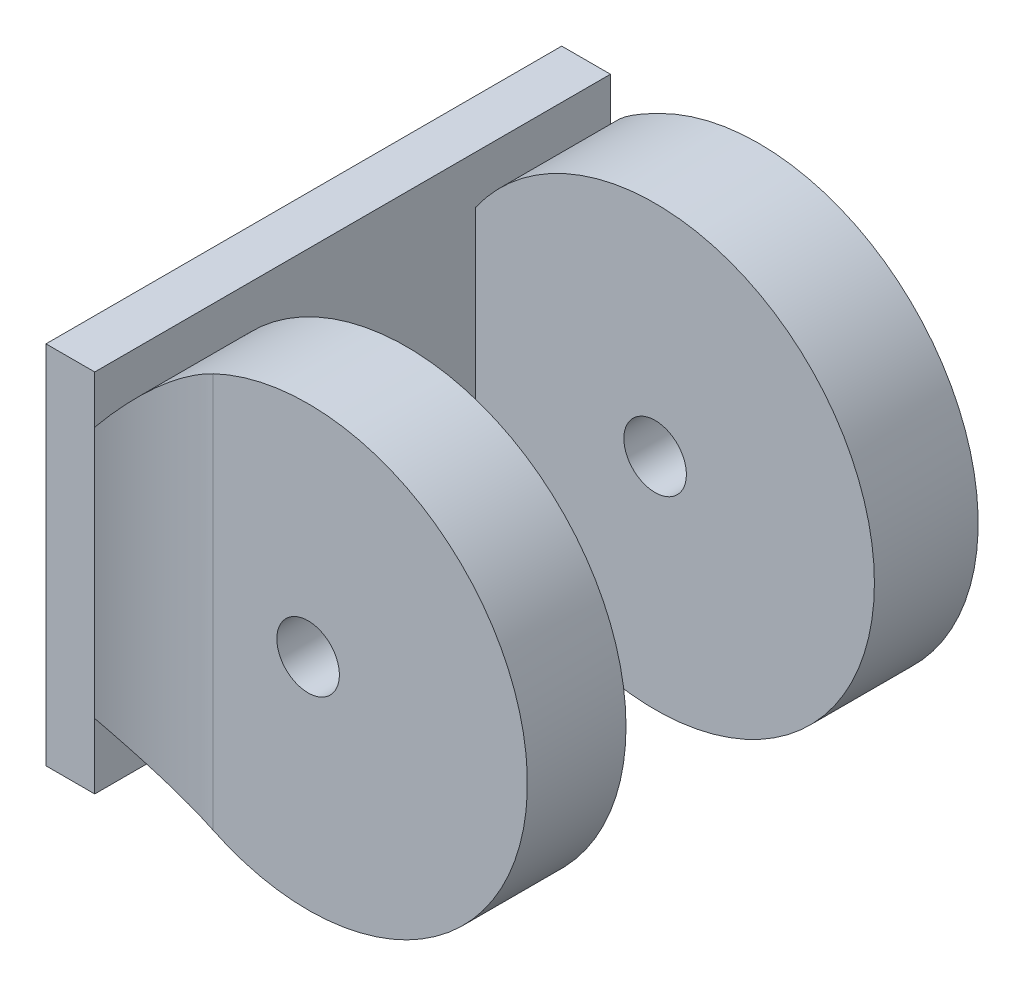
from build123d import *

# Parameters (mm, degrees)
BOSS_EXTRUDE1_DEPTH      = 9
BOSS_EXTRUDE1_DEPTH_BACK = 28
SKETCH1_R                = 18
SKETCH2_W                = 50.00806526
SKETCH2_H                = 20.388963247
CUT_EXTRUDE1_DEPTH       = 137
SKETCH6_R                = 2.56681782
CUT_EXTRUDE2_DEPTH       = 40
BOSS_EXTRUDE2_START      = 170
SKETCH7_W                = 42.331288986
SKETCH7_H                = 30
BOSS_EXTRUDE2_DEPTH      = 4
FILLET1_R                = 10


with BuildPart() as part:
    # Sketch1 → Boss-Extrude1 (new, two sides: drawn at the far end of the back side and taken through both)
    with BuildSketch(Plane(origin=(0, 0, 126.356389087), x_dir=(-1, 0, 0), z_dir=(0, 0, -1)).offset(-BOSS_EXTRUDE1_DEPTH_BACK)):
        with Locations((-188.724341924, 64.165727937)):
            Circle(SKETCH1_R)
    extrude(amount=BOSS_EXTRUDE1_DEPTH + BOSS_EXTRUDE1_DEPTH_BACK)

    # Sketch2 → Cut-Extrude1 (cut)
    with BuildSketch(Plane(origin=(-6.948170377, -29.446447031, 0), x_dir=(0.99748757373397, -0.07084165615171512, 3.115559675779194e-15), z_dir=(0.07084165615171512, 0.99748757373397, 0))):
        with Locations((192.53019978, -136.066593827)):
            Rectangle(SKETCH2_W, SKETCH2_H)
    extrude(amount=CUT_EXTRUDE1_DEPTH, mode=Mode.SUBTRACT)


with BuildPart() as cut_extrude1_piece_1:
    # of the separate pieces the step leaves, piece 1, a body of its own (cut_extrude1_pieces)
    add(part.part.solids().sort_by_distance((170.724341924, 64.165727937, 125.872112203))[0])


with BuildPart() as cut_extrude1_piece_2:
    # of the separate pieces the step leaves, piece 2, a body of its own (cut_extrude1_pieces)
    add(part.part.solids().sort_by_distance((170.724341924, 64.165727937, 146.26107545))[0])


with BuildPart() as cut_extrude2_tool:
    # Sketch6 → Cut-Extrude2 (new body)
    with BuildSketch(Plane(origin=(0, 0, 117.356389087), x_dir=(-1, 0, 0), z_dir=(0, 0, -1))):
        with Locations((-188.724341924, 64.165727937)):
            Circle(SKETCH6_R)
    extrude(amount=-CUT_EXTRUDE2_DEPTH)


with BuildPart() as cut_extrude1_piece_1_1:
    add(cut_extrude1_piece_1.part)

    # Cut-Extrude2: cut by cut_extrude2_tool
    add(cut_extrude2_tool.part, mode=Mode.SUBTRACT)



with BuildPart() as cut_extrude1_piece_2_1:
    add(cut_extrude1_piece_2.part)

    # Cut-Extrude2: cut by cut_extrude2_tool
    add(cut_extrude2_tool.part, mode=Mode.SUBTRACT)


with BuildPart() as cut_extrude1_piece_1_2:
    add(cut_extrude1_piece_1_1.part)

    add(cut_extrude1_piece_2_1.part)  # Boss-Extrude2 merges Cut-Extrude1 piece 2
    # Sketch7 → Boss-Extrude2 (add)
    with BuildSketch(Plane(origin=(0, 0, 0), x_dir=(0, 0, -1), z_dir=(1, 0, 0)).offset(BOSS_EXTRUDE2_START)):
        with Locations((-135.980164786, 63.44621419)):
            Rectangle(SKETCH7_W, SKETCH7_H)
    extrude(amount=BOSS_EXTRUDE2_DEPTH)

    # Fillet1
    # the kernel refuses this fillet: 10 mm, written as the material it adds along each edge
    with BuildSketch(Plane(origin=(174, 37.158405517, 117.356389087), x_dir=(0, 0, -1), z_dir=(0, 1, 0))) as fillet1_piece_1_section:
        with BuildLine():
            CenterArc((10, -6.66155229), FILLET1_R, 138.228987443, 41.771012557)
            Line((0, -6.66155229), (-0.2, -6.66155229))
            Line((-0.2, -6.66155229), (-0.2, 0))
            Line((-0.2, 0), (0, 0.2))
            ThreePointArc((0, 0.2), (1.270934397, 0.2), (2.39270617, 0.133231046))
            Line((2.39270617, 0.133231046), (2.541868794, 0))
        make_face()
    fillet1_piece_1 = extrude(amount=54.01464484, mode=Mode.PRIVATE)
    fillet1_piece_1 = fillet1_piece_1 & Plane(origin=(188.724341924, 64.165727937, 117.454219773), x_dir=(-1, 0, 0), z_dir=(0, 0, 1)) * Cylinder(18, 135, mode=Mode.PRIVATE)
    add(fillet1_piece_1)
    with BuildSketch(Plane(origin=(174, 36.49041805, 154.356389087), x_dir=(0, 0, 1), z_dir=(0, 1, 0))) as fillet1_piece_2_section:
        with BuildLine():
            CenterArc((10, 6.928747277), FILLET1_R, 180, 43.858101489)
            Line((0, 6.928747277), (-0.2, 6.928747277))
            Line((-0.2, 6.928747277), (-0.2, 0))
            Line((-0.2, 0), (0, -0.2))
            ThreePointArc((0, -0.2), (1.394710096, -0.2), (2.645208596, -0.138574946))
            Line((2.645208596, -0.138574946), (2.789420192, 0))
        make_face()
    fillet1_piece_2 = extrude(amount=55.350619773, mode=Mode.PRIVATE)
    fillet1_piece_2 = fillet1_piece_2 & Plane(origin=(188.724341924, 64.165727937, 154.260633817), x_dir=(-1, 0, 0), z_dir=(0, 0, -1)) * Cylinder(18, 139, mode=Mode.PRIVATE)
    add(fillet1_piece_2)


solid = cut_extrude1_piece_1_2.part
